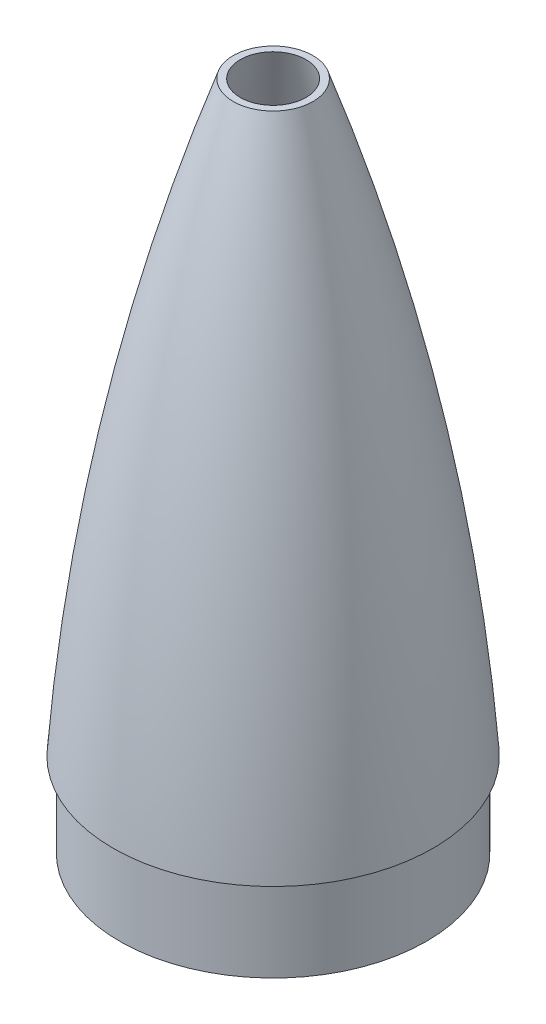
from build123d import *

# Parameters (mm, degrees)
SKETCH7_R           = 317.5
CUT_EXTRUDE2_DEPTH  = 101.6
SKETCH8_R           = 73.025
SKETCH8_R_2         = 69.85
BOSS_EXTRUDE1_DEPTH = 40


with BuildPart() as part:
    # Sketch2 → Revolve1 (revolve)
    with BuildSketch(Plane.XY):
        with BuildLine():
            Line((-76.2, 0), (-69.85, 0))
            ThreePointArc((-69.85, 0), (-46.178344337, 164.977710697), (0, 325.12))
            Line((0, 325.12), (0, 330.2))
            ThreePointArc((0, 330.2), (-50.970594074, 168.070137094), (-76.2, 0))
        make_face()
    revolve(axis=Axis((0, 330.2, 0), (0, -1, 0)))

    # Sketch7 → Cut-Extrude2 (cut)
    with BuildSketch(Plane(origin=(0, 381, 0), x_dir=(1, 0, 0), z_dir=(0, 1, 0))):
        Circle(SKETCH7_R)
    extrude(amount=-CUT_EXTRUDE2_DEPTH, mode=Mode.SUBTRACT)

    # Sketch8 → Boss-Extrude1 (add)
    with BuildSketch(Plane.XZ):
        Circle(SKETCH8_R)
        Circle(SKETCH8_R_2, mode=Mode.SUBTRACT)
    extrude(amount=BOSS_EXTRUDE1_DEPTH)


solid = part.part
